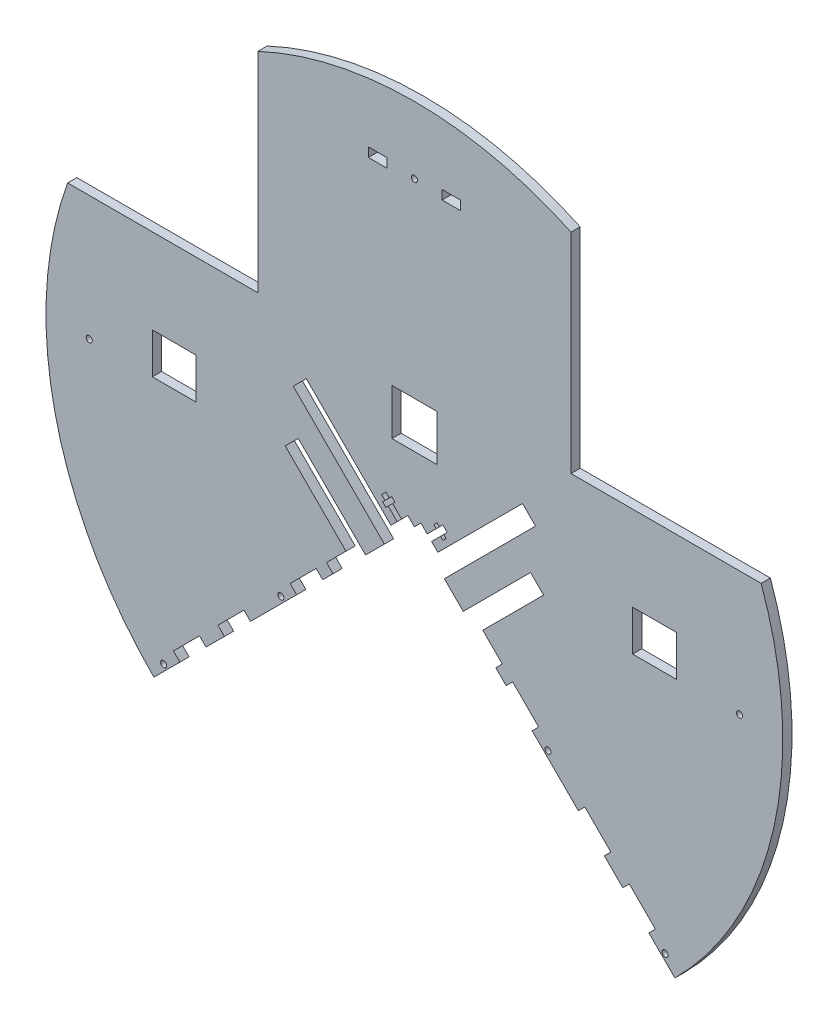
from build123d import *

# Parameters (mm, degrees)
SKETCH1_R           = 254
BOSS_EXTRUDE1_DEPTH = 6.35
CUT_EXTRUDE1_DEPTH  = 530.881249762
CUT_EXTRUDE2_DEPTH  = 466.964215177
SKETCH6_R           = 2.0955
CUT_EXTRUDE4_DEPTH  = 466.964215177
CUT_EXTRUDE6_DEPTH  = 466.964215177
CUT_EXTRUDE7_DEPTH  = 466.964215177
CUT_EXTRUDE8_DEPTH  = 466.964215177
SKETCH12_W          = 138.354833831
SKETCH12_H          = 159.746045219
CUT_EXTRUDE10_DEPTH = 466.964215177
SKETCH13_W          = 30.235101182
SKETCH13_H          = 28.022776705
SKETCH13_W_2        = 30.972542674
SKETCH13_H_2        = 31.709984167
CUT_EXTRUDE11_DEPTH = 466.964215177
SKETCH17_R          = 2.1209
SKETCH17_R_2        = 2.1336
SKETCH17_W          = 12.7
SKETCH17_H          = 6.35
CUT_EXTRUDE12_DEPTH = 466.964215177


with BuildPart() as part:
    # Sketch1 → Boss-Extrude1 (new body)
    with BuildSketch(Plane.XY):
        with Locations((0, -210.99227558)):
            Circle(SKETCH1_R)
    extrude(amount=BOSS_EXTRUDE1_DEPTH)

    # Sketch3 → Cut-Extrude1 (cut, through all)
    with BuildSketch(Plane(origin=(0, 0, 0), x_dir=(-1, 0, 0), z_dir=(0, 0, -1))):
        with BuildLine():
            Line((179.605122421, -390.597398001), (0, -210.99227558))
            Line((0, -210.99227558), (-179.605122421, -390.597398001))
            ThreePointArc((-179.605122421, -390.597398001), (0, -464.99227558), (179.605122421, -390.597398001))
        make_face()
    extrude(amount=-CUT_EXTRUDE1_DEPTH, mode=Mode.SUBTRACT)

    # Sketch4 → Cut-Extrude2 (cut, through all)
    with BuildSketch(Plane.XY.offset(6.35)):
        Polygon((-161.644610179, -372.636885759), (-166.13473824, -368.146757699), (-148.174225998, -350.186245456), (-143.684097937, -354.676373517), align=None)
        Polygon((-130.96805527, -341.960330849), (-135.45818333, -337.470202789), (-117.497671088, -319.509690547), (-113.007543028, -323.999818607), align=None)
        Polygon((-81.190495591, -292.18277117), (-85.680623651, -287.69264311), (-67.720111409, -269.732130868), (-63.229983348, -274.222258928), align=None)
        Polygon((-56.126600757, -267.118876336), (-60.616728817, -262.628748276), (-38.166088515, -240.178107973), (-33.675960454, -244.668236034), align=None)
        Polygon((-11.689323621, -222.681599201), (-16.179451682, -218.19147114), (-4.490128061, -206.502147519), (0, -210.99227558), align=None)
    cut_extrude2 = extrude(amount=-CUT_EXTRUDE2_DEPTH, mode=Mode.SUBTRACT)

    # Mirror1: Cut-Extrude2 across plane
    add(cut_extrude2.mirror(Plane(origin=(0, 0, 0), x_dir=(0, 0, 1), z_dir=(1, 0, 0))), mode=Mode.SUBTRACT)

    # Sketch6 → Cut-Extrude4 (cut, through all)
    with BuildSketch(Plane.XY.offset(6.35)):
        with Locations((-172.869930331, -379.37207785)):
            Circle(SKETCH6_R)
        with Locations((-92.047625241, -298.54977276)):
            Circle(SKETCH6_R)
    cut_extrude4 = extrude(amount=-CUT_EXTRUDE4_DEPTH, mode=Mode.SUBTRACT)

    # Mirror2: Cut-Extrude4 across plane
    add(cut_extrude4.mirror(Plane(origin=(0, 0, 0), x_dir=(0, 0, 1), z_dir=(1, 0, 0))), mode=Mode.SUBTRACT)

    # Sketch8 → Cut-Extrude6 (cut, through all)
    with BuildSketch(Plane.XY.offset(6.35)):
        Polygon((-20.669579742, -231.661855322), (-11.689323621, -222.681599201), (-74.551116468, -159.819806353), (-83.53137259, -168.800062475), align=None)
    cut_extrude6 = extrude(amount=-CUT_EXTRUDE6_DEPTH, mode=Mode.SUBTRACT)

    # Mirror3: Cut-Extrude6 across plane
    add(cut_extrude6.mirror(Plane(origin=(0, 0, 0), x_dir=(0, 0, 1), z_dir=(1, 0, 0))), mode=Mode.SUBTRACT)

    # Sketch9 → Cut-Extrude7 (cut, through all)
    with BuildSketch(Plane.XY.offset(6.35)):
        Polygon((-11.843472899, -213.855492358), (-8.826106843, -210.838126301), (-15.022483566, -204.641749578), (-13.388076952, -203.007342964), (-15.633140982, -200.762278934), (-17.267547597, -202.396685548), (-19.602414188, -200.061818956), (-22.619780245, -203.079185013), (-20.284913653, -205.414051604), (-21.919320267, -207.048458218), (-19.674256237, -209.293522249), (-18.039849623, -207.659115635), align=None)
    cut_extrude7 = extrude(amount=-CUT_EXTRUDE7_DEPTH, mode=Mode.SUBTRACT)

    # Mirror4: Cut-Extrude7 across plane
    add(cut_extrude7.mirror(Plane(origin=(0, 0, 0), x_dir=(0, 0, 1), z_dir=(1, 0, 0))), mode=Mode.SUBTRACT)

    # Sketch10 → Cut-Extrude8 (cut, through all)
    with BuildSketch(Plane.XY.offset(6.35)):
        Polygon((-80.080712821, -198.263483667), (-89.060968942, -207.243739788), (-42.656216575, -253.648492155), (-33.675960454, -244.668236034), align=None)
    cut_extrude8 = extrude(amount=-CUT_EXTRUDE8_DEPTH, mode=Mode.SUBTRACT)

    # Mirror5: Cut-Extrude8 across plane
    add(cut_extrude8.mirror(Plane(origin=(0, 0, 0), x_dir=(0, 0, 1), z_dir=(1, 0, 0))), mode=Mode.SUBTRACT)

    # Sketch12 → Cut-Extrude10 (cut, through all)
    with BuildSketch(Plane(origin=(0, 0, 0), x_dir=(-1, 0, 0), z_dir=(0, 0, -1))):
        with Locations((177.128041496, -45.34063784)):
            Rectangle(SKETCH12_W, SKETCH12_H)
        with Locations((-177.128041496, -45.34063784)):
            Rectangle(SKETCH12_W, SKETCH12_H)
    extrude(amount=-CUT_EXTRUDE10_DEPTH, mode=Mode.SUBTRACT)

    # Sketch13 → Cut-Extrude11 (cut, through all)
    with BuildSketch(Plane.XY.offset(6.35)):
        with Locations((-165.55561501, -197.761685289)):
            Rectangle(SKETCH13_W, SKETCH13_H)
        with Locations((0, -150.196709038)):
            Rectangle(SKETCH13_W_2, SKETCH13_H_2)
        with Locations((165.55561501, -197.761685289)):
            Rectangle(SKETCH13_W, SKETCH13_H)
    extrude(amount=-CUT_EXTRUDE11_DEPTH, mode=Mode.SUBTRACT)

    # Sketch17 → Cut-Extrude12 (cut, through all)
    with BuildSketch(Plane.XY.offset(6.35)):
        with Locations((224.155, -210.99227558)):
            Circle(SKETCH17_R)
        with Locations((-224.155, -210.99227558)):
            Circle(SKETCH17_R)
        with Locations((0, -3.175)):
            Circle(SKETCH17_R_2)
        with Locations((25.4, -3.175)):
            Rectangle(SKETCH17_W, SKETCH17_H)
        with Locations((-25.4, -3.175)):
            Rectangle(SKETCH17_W, SKETCH17_H)
    extrude(amount=-CUT_EXTRUDE12_DEPTH, mode=Mode.SUBTRACT)


solid = part.part
